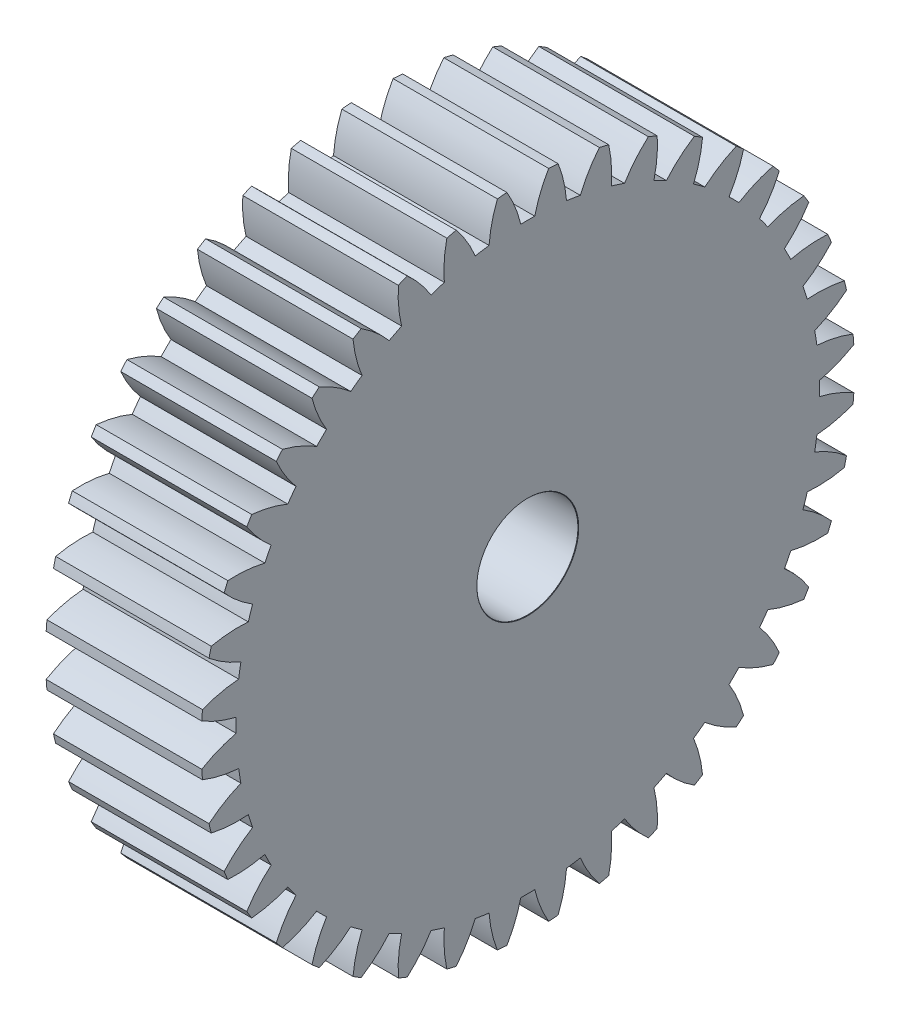
from build123d import *

# Parameters (mm, degrees)
STOCK_SPUR_GEAR_AM_1_OUTLINE_R = 0.4
STOCK_SPUR_GEAR_AM_1_DEPTH     = 12
MOVE_FACE1_BY                  = 2


# Read off the part's stored shape, not the designer's step: Stock-spur gear_am-1
with BuildPart() as part:
    # Stock-spur gear_am-1 outline → Stock-spur gear_am-1 (new body)
    with BuildSketch(Plane.YZ):
        with BuildLine():
            ThreePointArc((1.954693382, 20.908830043), (1.64764101, 20.935264008), (1.34023378, 20.957189063))
            ThreePointArc((1.34023378, 20.957189063), (0.811452619, 19.883840387), (0.448673268, 18.74363074))
            ThreePointArc((0.448673268, 18.74363074), (0, 18.749), (-0.448673268, 18.74363074))
            ThreePointArc((-0.448673268, 18.74363074), (-0.811452619, 19.883840387), (-1.34023378, 20.957189063))
            ThreePointArc((-1.34023378, 20.957189063), (-1.64764101, 20.935264008), (-1.954693382, 20.908830043))
            ThreePointArc((-1.954693382, 20.908830043), (-2.309055643, 19.765976472), (-2.489000492, 18.583053504))
            ThreePointArc((-2.489000492, 18.583053504), (-2.932989785, 18.518168698), (-3.375299203, 18.442677579))
            ThreePointArc((-3.375299203, 18.442677579), (-3.911980225, 19.51209816), (-4.602159938, 20.489512535))
            ThreePointArc((-4.602159938, 20.489512535), (-4.902352641, 20.419768328), (-5.201489505, 20.345626236))
            ThreePointArc((-5.201489505, 20.345626236), (-5.372707292, 19.161408618), (-5.3653868, 17.964899819))
            ThreePointArc((-5.3653868, 17.964899819), (-5.793759628, 17.831358624), (-6.21881407, 17.687604489))
            ThreePointArc((-6.21881407, 17.687604489), (-6.916181894, 18.659903319), (-7.750765644, 19.517316207))
            ThreePointArc((-7.750765644, 19.517316207), (-8.03635208, 19.401470183), (-8.320207694, 19.281445587))
            ThreePointArc((-8.320207694, 19.281445587), (-8.304065056, 18.08502329), (-8.109659478, 16.904390677))
            ThreePointArc((-8.109659478, 16.904390677), (-8.51186788, 16.705481322), (-8.909201095, 16.497003875))
            ThreePointArc((-8.909201095, 16.497003875), (-9.750084211, 17.34823973), (-10.708521777, 18.06453878))
            ThreePointArc((-10.708521777, 18.06453878), (-10.972469859, 17.905443451), (-11.234054756, 17.742491756))
            ThreePointArc((-11.234054756, 17.742491756), (-11.030949179, 16.563324668), (-10.654245425, 15.427639334))
            ThreePointArc((-10.654245425, 15.427639334), (-11.020385696, 15.168259628), (-11.380214022, 14.900192275))
            ThreePointArc((-11.380214022, 14.900192275), (-12.343907097, 15.609404904), (-13.402598565, 16.166952456))
            ThreePointArc((-13.402598565, 16.166952456), (-13.638409015, 15.968525278), (-13.871282107, 15.766658895))
            ThreePointArc((-13.871282107, 15.766658895), (-13.486214724, 14.633782023), (-12.93648849, 13.57100831))
            ThreePointArc((-12.93648849, 13.57100831), (-13.25754504, 13.25754504), (-13.57100831, 12.93648849))
            ThreePointArc((-13.57100831, 12.93648849), (-14.633782023, 13.486214724), (-15.766658895, 13.871282107))
            ThreePointArc((-15.766658895, 13.871282107), (-15.968525278, 13.638409015), (-16.166952456, 13.402598565))
            ThreePointArc((-16.166952456, 13.402598565), (-15.609404904, 12.343907097), (-14.900192275, 11.380214022))
            ThreePointArc((-14.900192275, 11.380214022), (-15.168259628, 11.020385696), (-15.427639334, 10.654245425))
            ThreePointArc((-15.427639334, 10.654245425), (-16.563324668, 11.030949179), (-17.742491756, 11.234054756))
            ThreePointArc((-17.742491756, 11.234054756), (-17.905443451, 10.972469859), (-18.06453878, 10.708521777))
            ThreePointArc((-18.06453878, 10.708521777), (-17.34823973, 9.750084211), (-16.497003875, 8.909201095))
            ThreePointArc((-16.497003875, 8.909201095), (-16.705481322, 8.51186788), (-16.904390677, 8.109659478))
            ThreePointArc((-16.904390677, 8.109659478), (-18.08502329, 8.304065056), (-19.281445587, 8.320207694))
            ThreePointArc((-19.281445587, 8.320207694), (-19.401470183, 8.03635208), (-19.517316207, 7.750765644))
            ThreePointArc((-19.517316207, 7.750765644), (-18.659903319, 6.916181894), (-17.687604489, 6.21881407))
            ThreePointArc((-17.687604489, 6.21881407), (-17.831358624, 5.793759628), (-17.964899819, 5.3653868))
            ThreePointArc((-17.964899819, 5.3653868), (-19.161408618, 5.372707292), (-20.345626236, 5.201489505))
            ThreePointArc((-20.345626236, 5.201489505), (-20.419768328, 4.902352641), (-20.489512535, 4.602159938))
            ThreePointArc((-20.489512535, 4.602159938), (-19.51209816, 3.911980225), (-18.442677579, 3.375299203))
            ThreePointArc((-18.442677579, 3.375299203), (-18.518168698, 2.932989785), (-18.583053504, 2.489000492))
            ThreePointArc((-18.583053504, 2.489000492), (-19.765976472, 2.309055643), (-20.908830043, 1.954693382))
            ThreePointArc((-20.908830043, 1.954693382), (-20.935264008, 1.64764101), (-20.957189063, 1.34023378))
            ThreePointArc((-20.957189063, 1.34023378), (-19.883840387, 0.811452619), (-18.74363074, 0.448673268))
            ThreePointArc((-18.74363074, 0.448673268), (-18.749, 0), (-18.74363074, -0.448673268))
            ThreePointArc((-18.74363074, -0.448673268), (-19.883840387, -0.811452619), (-20.957189063, -1.34023378))
            ThreePointArc((-20.957189063, -1.34023378), (-20.935264008, -1.64764101), (-20.908830043, -1.954693382))
            ThreePointArc((-20.908830043, -1.954693382), (-19.765976472, -2.309055643), (-18.583053504, -2.489000492))
            ThreePointArc((-18.583053504, -2.489000492), (-18.518168698, -2.932989785), (-18.442677579, -3.375299203))
            ThreePointArc((-18.442677579, -3.375299203), (-19.51209816, -3.911980225), (-20.489512535, -4.602159938))
            ThreePointArc((-20.489512535, -4.602159938), (-20.419768328, -4.902352641), (-20.345626236, -5.201489505))
            ThreePointArc((-20.345626236, -5.201489505), (-19.161408618, -5.372707292), (-17.964899819, -5.3653868))
            ThreePointArc((-17.964899819, -5.3653868), (-17.831358624, -5.793759628), (-17.687604489, -6.21881407))
            ThreePointArc((-17.687604489, -6.21881407), (-18.659903319, -6.916181894), (-19.517316207, -7.750765644))
            ThreePointArc((-19.517316207, -7.750765644), (-19.401470183, -8.03635208), (-19.281445587, -8.320207694))
            ThreePointArc((-19.281445587, -8.320207694), (-18.08502329, -8.304065056), (-16.904390677, -8.109659478))
            ThreePointArc((-16.904390677, -8.109659478), (-16.705481322, -8.51186788), (-16.497003875, -8.909201095))
            ThreePointArc((-16.497003875, -8.909201095), (-17.34823973, -9.750084211), (-18.06453878, -10.708521777))
            ThreePointArc((-18.06453878, -10.708521777), (-17.905443451, -10.972469859), (-17.742491756, -11.234054756))
            ThreePointArc((-17.742491756, -11.234054756), (-16.563324668, -11.030949179), (-15.427639334, -10.654245425))
            ThreePointArc((-15.427639334, -10.654245425), (-15.168259628, -11.020385696), (-14.900192275, -11.380214022))
            ThreePointArc((-14.900192275, -11.380214022), (-15.609404904, -12.343907097), (-16.166952456, -13.402598565))
            ThreePointArc((-16.166952456, -13.402598565), (-15.968525278, -13.638409015), (-15.766658895, -13.871282107))
            ThreePointArc((-15.766658895, -13.871282107), (-14.633782023, -13.486214724), (-13.57100831, -12.93648849))
            ThreePointArc((-13.57100831, -12.93648849), (-13.25754504, -13.25754504), (-12.93648849, -13.57100831))
            ThreePointArc((-12.93648849, -13.57100831), (-13.486214724, -14.633782023), (-13.871282107, -15.766658895))
            ThreePointArc((-13.871282107, -15.766658895), (-13.638409015, -15.968525278), (-13.402598565, -16.166952456))
            ThreePointArc((-13.402598565, -16.166952456), (-12.343907097, -15.609404904), (-11.380214022, -14.900192275))
            ThreePointArc((-11.380214022, -14.900192275), (-11.020385696, -15.168259628), (-10.654245425, -15.427639334))
            ThreePointArc((-10.654245425, -15.427639334), (-11.030949179, -16.563324668), (-11.234054756, -17.742491756))
            ThreePointArc((-11.234054756, -17.742491756), (-10.972469859, -17.905443451), (-10.708521777, -18.06453878))
            ThreePointArc((-10.708521777, -18.06453878), (-9.750084211, -17.34823973), (-8.909201095, -16.497003875))
            ThreePointArc((-8.909201095, -16.497003875), (-8.51186788, -16.705481322), (-8.109659478, -16.904390677))
            ThreePointArc((-8.109659478, -16.904390677), (-8.304065056, -18.08502329), (-8.320207694, -19.281445587))
            ThreePointArc((-8.320207694, -19.281445587), (-8.03635208, -19.401470183), (-7.750765644, -19.517316207))
            ThreePointArc((-7.750765644, -19.517316207), (-6.916181894, -18.659903319), (-6.21881407, -17.687604489))
            ThreePointArc((-6.21881407, -17.687604489), (-5.793759628, -17.831358624), (-5.3653868, -17.964899819))
            ThreePointArc((-5.3653868, -17.964899819), (-5.372707292, -19.161408618), (-5.201489505, -20.345626236))
            ThreePointArc((-5.201489505, -20.345626236), (-4.902352641, -20.419768328), (-4.602159938, -20.489512535))
            ThreePointArc((-4.602159938, -20.489512535), (-3.911980225, -19.51209816), (-3.375299203, -18.442677579))
            ThreePointArc((-3.375299203, -18.442677579), (-2.932989785, -18.518168698), (-2.489000492, -18.583053504))
            ThreePointArc((-2.489000492, -18.583053504), (-2.309055643, -19.765976472), (-1.954693382, -20.908830043))
            ThreePointArc((-1.954693382, -20.908830043), (-1.64764101, -20.935264008), (-1.34023378, -20.957189063))
            ThreePointArc((-1.34023378, -20.957189063), (-0.811452619, -19.883840387), (-0.448673268, -18.74363074))
            ThreePointArc((-0.448673268, -18.74363074), (0, -18.749), (0.448673268, -18.74363074))
            ThreePointArc((0.448673268, -18.74363074), (0.811452619, -19.883840387), (1.34023378, -20.957189063))
            ThreePointArc((1.34023378, -20.957189063), (1.64764101, -20.935264008), (1.954693382, -20.908830043))
            ThreePointArc((1.954693382, -20.908830043), (2.309055643, -19.765976472), (2.489000492, -18.583053504))
            ThreePointArc((2.489000492, -18.583053504), (2.932989785, -18.518168698), (3.375299203, -18.442677579))
            ThreePointArc((3.375299203, -18.442677579), (3.911980225, -19.51209816), (4.602159938, -20.489512535))
            ThreePointArc((4.602159938, -20.489512535), (4.902352641, -20.419768328), (5.201489505, -20.345626236))
            ThreePointArc((5.201489505, -20.345626236), (5.372707292, -19.161408618), (5.3653868, -17.964899819))
            ThreePointArc((5.3653868, -17.964899819), (5.793759628, -17.831358624), (6.21881407, -17.687604489))
            ThreePointArc((6.21881407, -17.687604489), (6.916181894, -18.659903319), (7.750765644, -19.517316207))
            ThreePointArc((7.750765644, -19.517316207), (8.03635208, -19.401470183), (8.320207694, -19.281445587))
            ThreePointArc((8.320207694, -19.281445587), (8.304065056, -18.08502329), (8.109659478, -16.904390677))
            ThreePointArc((8.109659478, -16.904390677), (8.51186788, -16.705481322), (8.909201095, -16.497003875))
            ThreePointArc((8.909201095, -16.497003875), (9.750084211, -17.34823973), (10.708521777, -18.06453878))
            ThreePointArc((10.708521777, -18.06453878), (10.972469859, -17.905443451), (11.234054756, -17.742491756))
            ThreePointArc((11.234054756, -17.742491756), (11.030949179, -16.563324668), (10.654245425, -15.427639334))
            ThreePointArc((10.654245425, -15.427639334), (11.020385696, -15.168259628), (11.380214022, -14.900192275))
            ThreePointArc((11.380214022, -14.900192275), (12.343907097, -15.609404904), (13.402598565, -16.166952456))
            ThreePointArc((13.402598565, -16.166952456), (13.638409015, -15.968525278), (13.871282107, -15.766658895))
            ThreePointArc((13.871282107, -15.766658895), (13.486214724, -14.633782023), (12.93648849, -13.57100831))
            ThreePointArc((12.93648849, -13.57100831), (13.25754504, -13.25754504), (13.57100831, -12.93648849))
            ThreePointArc((13.57100831, -12.93648849), (14.633782023, -13.486214724), (15.766658895, -13.871282107))
            ThreePointArc((15.766658895, -13.871282107), (15.968525278, -13.638409015), (16.166952456, -13.402598565))
            ThreePointArc((16.166952456, -13.402598565), (15.609404904, -12.343907097), (14.900192275, -11.380214022))
            ThreePointArc((14.900192275, -11.380214022), (15.168259628, -11.020385696), (15.427639334, -10.654245425))
            ThreePointArc((15.427639334, -10.654245425), (16.563324668, -11.030949179), (17.742491756, -11.234054756))
            ThreePointArc((17.742491756, -11.234054756), (17.905443451, -10.972469859), (18.06453878, -10.708521777))
            ThreePointArc((18.06453878, -10.708521777), (17.34823973, -9.750084211), (16.497003875, -8.909201095))
            ThreePointArc((16.497003875, -8.909201095), (16.705481322, -8.51186788), (16.904390677, -8.109659478))
            ThreePointArc((16.904390677, -8.109659478), (18.08502329, -8.304065056), (19.281445587, -8.320207694))
            ThreePointArc((19.281445587, -8.320207694), (19.401470183, -8.03635208), (19.517316207, -7.750765644))
            ThreePointArc((19.517316207, -7.750765644), (18.659903319, -6.916181894), (17.687604489, -6.21881407))
            ThreePointArc((17.687604489, -6.21881407), (17.831358624, -5.793759628), (17.964899819, -5.3653868))
            ThreePointArc((17.964899819, -5.3653868), (19.161408618, -5.372707292), (20.345626236, -5.201489505))
            ThreePointArc((20.345626236, -5.201489505), (20.419768328, -4.902352641), (20.489512535, -4.602159938))
            ThreePointArc((20.489512535, -4.602159938), (19.51209816, -3.911980225), (18.442677579, -3.375299203))
            ThreePointArc((18.442677579, -3.375299203), (18.518168698, -2.932989785), (18.583053504, -2.489000492))
            ThreePointArc((18.583053504, -2.489000492), (19.765976472, -2.309055643), (20.908830043, -1.954693382))
            ThreePointArc((20.908830043, -1.954693382), (20.935264008, -1.64764101), (20.957189063, -1.34023378))
            ThreePointArc((20.957189063, -1.34023378), (19.883840387, -0.811452619), (18.74363074, -0.448673268))
            ThreePointArc((18.74363074, -0.448673268), (18.749, 0), (18.74363074, 0.448673268))
            ThreePointArc((18.74363074, 0.448673268), (19.883840387, 0.811452619), (20.957189063, 1.34023378))
            ThreePointArc((20.957189063, 1.34023378), (20.935264008, 1.64764101), (20.908830043, 1.954693382))
            ThreePointArc((20.908830043, 1.954693382), (19.765976472, 2.309055643), (18.583053504, 2.489000492))
            ThreePointArc((18.583053504, 2.489000492), (18.518168698, 2.932989785), (18.442677579, 3.375299203))
            ThreePointArc((18.442677579, 3.375299203), (19.51209816, 3.911980225), (20.489512535, 4.602159938))
            ThreePointArc((20.489512535, 4.602159938), (20.419768328, 4.902352641), (20.345626236, 5.201489505))
            ThreePointArc((20.345626236, 5.201489505), (19.161408618, 5.372707292), (17.964899819, 5.3653868))
            ThreePointArc((17.964899819, 5.3653868), (17.831358624, 5.793759628), (17.687604489, 6.21881407))
            ThreePointArc((17.687604489, 6.21881407), (18.659903319, 6.916181894), (19.517316207, 7.750765644))
            ThreePointArc((19.517316207, 7.750765644), (19.401470183, 8.03635208), (19.281445587, 8.320207694))
            ThreePointArc((19.281445587, 8.320207694), (18.08502329, 8.304065056), (16.904390677, 8.109659478))
            ThreePointArc((16.904390677, 8.109659478), (16.705481322, 8.51186788), (16.497003875, 8.909201095))
            ThreePointArc((16.497003875, 8.909201095), (17.34823973, 9.750084211), (18.06453878, 10.708521777))
            ThreePointArc((18.06453878, 10.708521777), (17.905443451, 10.972469859), (17.742491756, 11.234054756))
            ThreePointArc((17.742491756, 11.234054756), (16.563324668, 11.030949179), (15.427639334, 10.654245425))
            ThreePointArc((15.427639334, 10.654245425), (15.168259628, 11.020385696), (14.900192275, 11.380214022))
            ThreePointArc((14.900192275, 11.380214022), (15.609404904, 12.343907097), (16.166952456, 13.402598565))
            ThreePointArc((16.166952456, 13.402598565), (15.968525278, 13.638409015), (15.766658895, 13.871282107))
            ThreePointArc((15.766658895, 13.871282107), (14.633782023, 13.486214724), (13.57100831, 12.93648849))
            ThreePointArc((13.57100831, 12.93648849), (13.25754504, 13.25754504), (12.93648849, 13.57100831))
            ThreePointArc((12.93648849, 13.57100831), (13.486214724, 14.633782023), (13.871282107, 15.766658895))
            ThreePointArc((13.871282107, 15.766658895), (13.638409015, 15.968525278), (13.402598565, 16.166952456))
            ThreePointArc((13.402598565, 16.166952456), (12.343907097, 15.609404904), (11.380214022, 14.900192275))
            ThreePointArc((11.380214022, 14.900192275), (11.020385696, 15.168259628), (10.654245425, 15.427639334))
            ThreePointArc((10.654245425, 15.427639334), (11.030949179, 16.563324668), (11.234054756, 17.742491756))
            ThreePointArc((11.234054756, 17.742491756), (10.972469859, 17.905443451), (10.708521777, 18.06453878))
            ThreePointArc((10.708521777, 18.06453878), (9.750084211, 17.34823973), (8.909201095, 16.497003875))
            ThreePointArc((8.909201095, 16.497003875), (8.51186788, 16.705481322), (8.109659478, 16.904390677))
            ThreePointArc((8.109659478, 16.904390677), (8.304065056, 18.08502329), (8.320207694, 19.281445587))
            ThreePointArc((8.320207694, 19.281445587), (8.03635208, 19.401470183), (7.750765644, 19.517316207))
            ThreePointArc((7.750765644, 19.517316207), (6.916181894, 18.659903319), (6.21881407, 17.687604489))
            ThreePointArc((6.21881407, 17.687604489), (5.793759628, 17.831358624), (5.3653868, 17.964899819))
            ThreePointArc((5.3653868, 17.964899819), (5.372707292, 19.161408618), (5.201489505, 20.345626236))
            ThreePointArc((5.201489505, 20.345626236), (4.902352641, 20.419768328), (4.602159938, 20.489512535))
            ThreePointArc((4.602159938, 20.489512535), (3.911980225, 19.51209816), (3.375299203, 18.442677579))
            ThreePointArc((3.375299203, 18.442677579), (2.932989785, 18.518168698), (2.489000492, 18.583053504))
            ThreePointArc((2.489000492, 18.583053504), (2.309055643, 19.765976472), (1.954693382, 20.908830043))
        make_face()
        Circle(STOCK_SPUR_GEAR_AM_1_OUTLINE_R, mode=Mode.SUBTRACT)
    extrude(amount=STOCK_SPUR_GEAR_AM_1_DEPTH)

    # Sketch5 → CBORE for M3 SHCS1 (revolve, cut)
    with BuildSketch(Plane(origin=(12, 0, 0), x_dir=(0, 0, -1), z_dir=(0, 1, 0))):
        Polygon((0, 0), (0, 12), (1.7, 12), (1.7, 5), (3.25, 5), (3.25, 0.025), (3.275, 0), align=None)
    revolve(axis=Axis((18.35, 0, 0), (-1, 0, 0)), mode=Mode.SUBTRACT)

    # Move Face1: a face moved inward by 2.0
    extrude(part.faces().sort_by_distance((0, 0, -10.478594532))[0], amount=MOVE_FACE1_BY, dir=(1, 0, 0), mode=Mode.SUBTRACT)


solid = part.part
